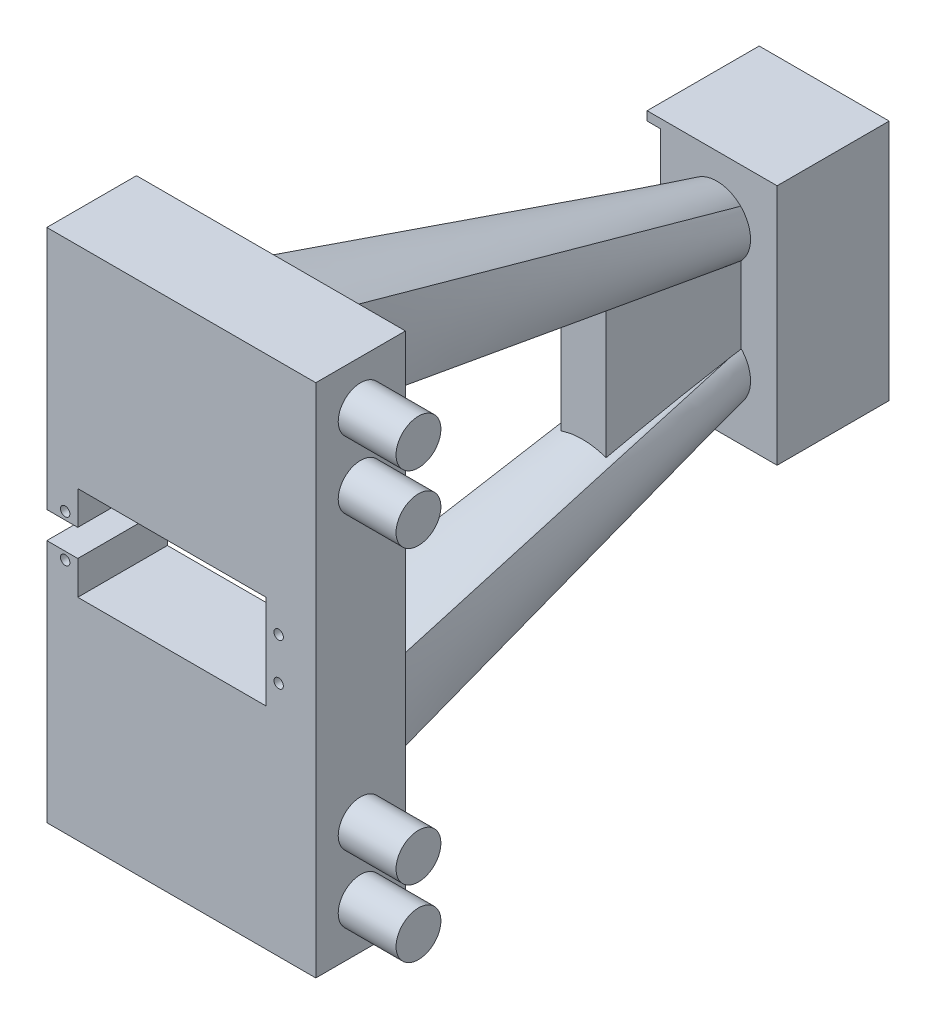
from build123d import *

# Parameters (mm, degrees)
SKETCH_5_W            = 60
SKETCH_5_H            = 115
EXTRUDE_2_DEPTH       = 20
SKETCH_1_R            = 1.05
CUT_EXTRUDE_4_DEPTH   = 20
SKETCH_6_R            = 5
EXTRUDE_3_DEPTH       = 13
EXTRUDE_6_DEPTH       = 3
EXTRUDE_6_DEPTH_BACK  = 26
SKETCH_13_W           = 25
SKETCH_13_H           = 54
SKETCH_16_W           = 22
SKETCH_16_H           = 50
CUT_EXTRUDE_9_DEPTH   = 3
SKETCH_17_W           = 5
SKETCH_17_H           = 15
CUT_EXTRUDE_10_DEPTH  = 8
EXTRUDE_13_DEPTH      = 5
EXTRUDE_13_DEPTH_BACK = 5


with BuildPart() as part:
    # 草圖5 → 填料-伸長2 (new body)
    with BuildSketch(Plane.XY):
        with Locations((85.095319229, -3)):
            Rectangle(SKETCH_5_W, SKETCH_5_H)
    extrude(amount=EXTRUDE_2_DEPTH)

    # 草圖1 → 除料-伸長4 (cut)
    with BuildSketch(Plane.XY):
        with Locations((59.19, 1.7)):
            Circle(SKETCH_1_R)
        with Locations((106.81, 1.7)):
            Circle(SKETCH_1_R)
        with Locations(Location((106.81, -7.7, 0), (0, 0, 180))):
            Circle(SKETCH_1_R)
        with Locations(Location((59.19, -7.7, 0), (0, 0, 180))):
            Circle(SKETCH_1_R)
        Polygon((55, -3), (55, 0), (62, 0), (62, 7.5), (104, 7.5), (104, -13.5), (62, -13.5), (62, -6), (55, -6), align=None)
    extrude(amount=CUT_EXTRUDE_4_DEPTH, mode=Mode.SUBTRACT)

    # 草圖6 → 填料-伸長3 (add)
    with BuildSketch(Plane(origin=(115, 0, 0), x_dir=(0, 0, -1), z_dir=(1, 0, 0))):
        with Locations(Location((-10, 44.5, 0), (0, 0, 180))):
            Circle(SKETCH_6_R)
        with Locations(Location((-10, 29.5, 0), (0, 0, 180))):
            Circle(SKETCH_6_R)
        with Locations(Location((-10, -35.5, 0), (0, 0, 180))):
            Circle(SKETCH_6_R)
        with Locations(Location((-10, -50.5, 0), (0, 0, 180))):
            Circle(SKETCH_6_R)
    extrude(amount=EXTRUDE_3_DEPTH)


with BuildPart() as body_2:
    # 草圖13 → 填料-伸長6 (new, two sides: drawn at the far end of the back side and taken through both)
    with BuildSketch(Plane(origin=(95, 0, 0), x_dir=(0, 0, -1), z_dir=(1, 0, 0)).offset(-EXTRUDE_6_DEPTH_BACK)):
        with Locations((112.5, -3)):
            Rectangle(SKETCH_13_W, SKETCH_13_H)
    extrude(amount=EXTRUDE_6_DEPTH + EXTRUDE_6_DEPTH_BACK)

    # 草圖16 → 除料-伸長9 (cut)
    with BuildSketch(Plane(origin=(69, 0, 0), x_dir=(0, 0, -1), z_dir=(1, 0, 0))):
        with Locations((111, -3)):
            Rectangle(SKETCH_16_W, SKETCH_16_H)
    extrude(amount=CUT_EXTRUDE_9_DEPTH, mode=Mode.SUBTRACT)

    # 草圖17 → 除料-伸長10 (cut)
    with BuildSketch(Plane(origin=(69, 0, 0), x_dir=(0, 0, -1), z_dir=(1, 0, 0))):
        with Locations((102.5, -3)):
            Rectangle(SKETCH_17_W, SKETCH_17_H)
    extrude(amount=CUT_EXTRUDE_10_DEPTH, mode=Mode.SUBTRACT)


with BuildPart() as body_3:
    # 草圖21 → 填料-伸長13 (new, two sides: drawn at the far end of the back side and taken through both)
    with BuildSketch(Plane(origin=(85, 0, 0), x_dir=(0, 0, -1), z_dir=(1, 0, 0)).offset(-EXTRUDE_13_DEPTH_BACK)):
        Polygon((69.839876567, 12.283695651), (69.839876567, -18.283695651), (100, -11.88497246), (99.903514788, -3), (100, 5.88497246), align=None)
    extrude(amount=EXTRUDE_13_DEPTH + EXTRUDE_13_DEPTH_BACK)


with BuildPart() as body_4:
    # Knit 1: read off the stored shape, not the designer's step
    # Knit 1: loft between two sections, ruled curve by curve
    knit_1_from = [
        Edge.make_bspline([(79.266895317, 5.377196179, -100), (79.579395317, 5.064696179, -100), (79.931362244, 4.768290315, -100), (80.709511323, 4.233165726, -100), (81.135733214, 3.994620259, -100), (82.046998926, 3.600245646, -100), (82.531971403, 3.444609801, -100), (83.534778832, 3.234670337, -100), (84.052429223, 3.180497037, -100), (85.087963129, 3.180497037, -100), (85.60561352, 3.234670337, -100), (86.608420949, 3.444609801, -100), (87.093393426, 3.600245646, -100), (88.004659138, 3.994620259, -100), (88.430881029, 4.233165726, -100), (89.209030109, 4.768290315, -100), (89.560997035, 5.064696179, -100), (89.873497035, 5.377196179, -100)], [0, 0, 0, 0, 0.125, 0.125, 0.25, 0.25, 0.375, 0.375, 0.5, 0.5, 0.625, 0.625, 0.75, 0.75, 0.875, 0.875, 1, 1, 1, 1], 3),
        Edge.make_bspline([(89.873497035, 5.377196179, -100), (90.185997035, 5.689696179, -100), (90.482402899, 6.041663105, -100), (91.017527488, 6.819812184, -100), (91.256072955, 7.246034075, -100), (91.650447568, 8.157299787, -100), (91.806083413, 8.642272265, -100), (92.016022877, 9.645079694, -100), (92.070196176, 10.162730084, -100), (92.070196176, 11.19826399, -100), (92.016022877, 11.715914381, -100), (91.806083413, 12.71872181, -100), (91.650447568, 13.203694288, -100), (91.256072955, 14.11496, -100), (91.017527488, 14.541181891, -100), (90.482402899, 15.31933097, -100), (90.185997035, 15.671297896, -100), (89.873497035, 15.983797896, -100)], [0, 0, 0, 0, 0.125, 0.125, 0.25, 0.25, 0.375, 0.375, 0.5, 0.5, 0.625, 0.625, 0.75, 0.75, 0.875, 0.875, 1, 1, 1, 1], 3),
        Edge.make_bspline([(79.266895317, 15.983797896, -100), (78.954395317, 15.671297896, -100), (78.657989454, 15.31933097, -100), (78.122864864, 14.541181891, -100), (77.884319398, 14.11496, -100), (77.489944785, 13.203694288, -100), (77.334308939, 12.71872181, -100), (77.124369476, 11.715914381, -100), (77.070196176, 11.19826399, -100), (77.070196176, 10.162730084, -100), (77.124369476, 9.645079694, -100), (77.334308939, 8.642272265, -100), (77.489944785, 8.157299787, -100), (77.884319398, 7.246034075, -100), (78.122864864, 6.819812184, -100), (78.657989454, 6.041663105, -100), (78.954395317, 5.689696179, -100), (79.266895317, 5.377196179, -100)], [0, 0, 0, 0, 0.125, 0.125, 0.25, 0.25, 0.375, 0.375, 0.5, 0.5, 0.625, 0.625, 0.75, 0.75, 0.875, 0.875, 1, 1, 1, 1], 3),
        Edge.make_bspline([(89.873497035, 15.983797896, -100), (89.560997035, 16.296297896, -100), (89.209030109, 16.59270376, -100), (88.430881029, 17.127828349, -100), (88.004659138, 17.366373816, -100), (87.093393426, 17.760748429, -100), (86.608420949, 17.916384274, -100), (85.60561352, 18.126323738, -100), (85.087963129, 18.180497037, -100), (84.052429223, 18.180497037, -100), (83.534778832, 18.126323738, -100), (82.531971403, 17.916384274, -100), (82.046998926, 17.760748429, -100), (81.135733214, 17.366373816, -100), (80.709511323, 17.127828349, -100), (79.931362244, 16.59270376, -100), (79.579395317, 16.296297896, -100), (79.266895317, 15.983797896, -100)], [0, 0, 0, 0, 0.125, 0.125, 0.25, 0.25, 0.375, 0.375, 0.5, 0.5, 0.625, 0.625, 0.75, 0.75, 0.875, 0.875, 1, 1, 1, 1], 3),
    ]
    knit_1_to = [
        Edge.make_bspline([(75, 27.5, 0), (75.833333333, 27.5, 0), (76.666666667, 27.5, 0), (78.333333333, 27.5, 0), (79.166666667, 27.5, 0), (80.833333333, 27.5, 0), (81.666666667, 27.5, 0), (83.333333333, 27.5, 0), (84.166666667, 27.5, 0), (85.833333333, 27.5, 0), (86.666666667, 27.5, 0), (88.333333333, 27.5, 0), (89.166666667, 27.5, 0), (90.833333333, 27.5, 0), (91.666666667, 27.5, 0), (93.333333333, 27.5, 0), (94.166666667, 27.5, 0), (95, 27.5, 0)], [0, 0, 0, 0, 0.125, 0.125, 0.25, 0.25, 0.375, 0.375, 0.5, 0.5, 0.625, 0.625, 0.75, 0.75, 0.875, 0.875, 1, 1, 1, 1], 3),
        Edge.make_bspline([(95, 27.5, 0), (95, 28.333333333, 0), (95, 29.166666667, 0), (95, 30.833333333, 0), (95, 31.666666667, 0), (95, 33.333333333, 0), (95, 34.166666667, 0), (95, 35.833333333, 0), (95, 36.666666667, 0), (95, 38.333333333, 0), (95, 39.166666667, 0), (95, 40.833333333, 0), (95, 41.666666667, 0), (95, 43.333333333, 0), (95, 44.166666667, 0), (95, 45.833333333, 0), (95, 46.666666667, 0), (95, 47.5, 0)], [0, 0, 0, 0, 0.125, 0.125, 0.25, 0.25, 0.375, 0.375, 0.5, 0.5, 0.625, 0.625, 0.75, 0.75, 0.875, 0.875, 1, 1, 1, 1], 3),
        Edge.make_bspline([(75, 47.5, 0), (75, 46.666666667, 0), (75, 45.833333333, 0), (75, 44.166666667, 0), (75, 43.333333333, 0), (75, 41.666666667, 0), (75, 40.833333333, 0), (75, 39.166666667, 0), (75, 38.333333333, 0), (75, 36.666666667, 0), (75, 35.833333333, 0), (75, 34.166666667, 0), (75, 33.333333333, 0), (75, 31.666666667, 0), (75, 30.833333333, 0), (75, 29.166666667, 0), (75, 28.333333333, 0), (75, 27.5, 0)], [0, 0, 0, 0, 0.125, 0.125, 0.25, 0.25, 0.375, 0.375, 0.5, 0.5, 0.625, 0.625, 0.75, 0.75, 0.875, 0.875, 1, 1, 1, 1], 3),
        Edge.make_bspline([(95, 47.5, 0), (94.166666667, 47.5, 0), (93.333333333, 47.5, 0), (91.666666667, 47.5, 0), (90.833333333, 47.5, 0), (89.166666667, 47.5, 0), (88.333333333, 47.5, 0), (86.666666667, 47.5, 0), (85.833333333, 47.5, 0), (84.166666667, 47.5, 0), (83.333333333, 47.5, 0), (81.666666667, 47.5, 0), (80.833333333, 47.5, 0), (79.166666667, 47.5, 0), (78.333333333, 47.5, 0), (76.666666667, 47.5, 0), (75.833333333, 47.5, 0), (75, 47.5, 0)], [0, 0, 0, 0, 0.125, 0.125, 0.25, 0.25, 0.375, 0.375, 0.5, 0.5, 0.625, 0.625, 0.75, 0.75, 0.875, 0.875, 1, 1, 1, 1], 3),
    ]
    knit_1 = Solid(Shell([*[Face.make_surface_from_curves(knit_1_from[k], knit_1_to[k]) for k in range(4)], Face(Wire(knit_1_from)), Face(Wire(knit_1_to))]))
    add(knit_1)


with BuildPart() as body_5:
    # Knit 2: read off the stored shape, not the designer's step
    # Knit 2: loft between two sections, ruled curve by curve
    knit_2_from = [
        Edge.make_bspline([(79.266895317, -21.983797896, -100), (79.579395317, -22.296297896, -100), (79.931362244, -22.59270376, -100), (80.709511323, -23.127828349, -100), (81.135733214, -23.366373816, -100), (82.046998926, -23.760748429, -100), (82.531971403, -23.916384274, -100), (83.534778832, -24.126323738, -100), (84.052429223, -24.180497037, -100), (85.087963129, -24.180497037, -100), (85.60561352, -24.126323738, -100), (86.608420949, -23.916384274, -100), (87.093393426, -23.760748429, -100), (88.004659138, -23.366373816, -100), (88.430881029, -23.127828349, -100), (89.209030109, -22.59270376, -100), (89.560997035, -22.296297896, -100), (89.873497035, -21.983797896, -100)], [0, 0, 0, 0, 0.125, 0.125, 0.25, 0.25, 0.375, 0.375, 0.5, 0.5, 0.625, 0.625, 0.75, 0.75, 0.875, 0.875, 1, 1, 1, 1], 3),
        Edge.make_bspline([(89.873497035, -21.983797896, -100), (90.185997035, -21.671297896, -100), (90.482402899, -21.31933097, -100), (91.017527488, -20.541181891, -100), (91.256072955, -20.11496, -100), (91.650447568, -19.203694288, -100), (91.806083413, -18.71872181, -100), (92.016022877, -17.715914381, -100), (92.070196176, -17.19826399, -100), (92.070196176, -16.162730084, -100), (92.016022877, -15.645079694, -100), (91.806083413, -14.642272265, -100), (91.650447568, -14.157299787, -100), (91.256072955, -13.246034075, -100), (91.017527488, -12.819812184, -100), (90.482402899, -12.041663105, -100), (90.185997035, -11.689696179, -100), (89.873497035, -11.377196179, -100)], [0, 0, 0, 0, 0.125, 0.125, 0.25, 0.25, 0.375, 0.375, 0.5, 0.5, 0.625, 0.625, 0.75, 0.75, 0.875, 0.875, 1, 1, 1, 1], 3),
        Edge.make_bspline([(79.266895317, -11.377196179, -100), (78.954395317, -11.689696179, -100), (78.657989454, -12.041663105, -100), (78.122864864, -12.819812184, -100), (77.884319398, -13.246034075, -100), (77.489944785, -14.157299787, -100), (77.334308939, -14.642272265, -100), (77.124369476, -15.645079694, -100), (77.070196176, -16.162730084, -100), (77.070196176, -17.19826399, -100), (77.124369476, -17.715914381, -100), (77.334308939, -18.71872181, -100), (77.489944785, -19.203694288, -100), (77.884319398, -20.11496, -100), (78.122864864, -20.541181891, -100), (78.657989454, -21.31933097, -100), (78.954395317, -21.671297896, -100), (79.266895317, -21.983797896, -100)], [0, 0, 0, 0, 0.125, 0.125, 0.25, 0.25, 0.375, 0.375, 0.5, 0.5, 0.625, 0.625, 0.75, 0.75, 0.875, 0.875, 1, 1, 1, 1], 3),
        Edge.make_bspline([(89.873497035, -11.377196179, -100), (89.560997035, -11.064696179, -100), (89.209030109, -10.768290315, -100), (88.430881029, -10.233165726, -100), (88.004659138, -9.994620259, -100), (87.093393426, -9.600245646, -100), (86.608420949, -9.444609801, -100), (85.60561352, -9.234670337, -100), (85.087963129, -9.180497037, -100), (84.052429223, -9.180497037, -100), (83.534778832, -9.234670337, -100), (82.531971403, -9.444609801, -100), (82.046998926, -9.600245646, -100), (81.135733214, -9.994620259, -100), (80.709511323, -10.233165726, -100), (79.931362244, -10.768290315, -100), (79.579395317, -11.064696179, -100), (79.266895317, -11.377196179, -100)], [0, 0, 0, 0, 0.125, 0.125, 0.25, 0.25, 0.375, 0.375, 0.5, 0.5, 0.625, 0.625, 0.75, 0.75, 0.875, 0.875, 1, 1, 1, 1], 3),
    ]
    knit_2_to = [
        Edge.make_bspline([(75, -53.5, 0), (75.833333333, -53.5, 0), (76.666666667, -53.5, 0), (78.333333333, -53.5, 0), (79.166666667, -53.5, 0), (80.833333333, -53.5, 0), (81.666666667, -53.5, 0), (83.333333333, -53.5, 0), (84.166666667, -53.5, 0), (85.833333333, -53.5, 0), (86.666666667, -53.5, 0), (88.333333333, -53.5, 0), (89.166666667, -53.5, 0), (90.833333333, -53.5, 0), (91.666666667, -53.5, 0), (93.333333333, -53.5, 0), (94.166666667, -53.5, 0), (95, -53.5, 0)], [0, 0, 0, 0, 0.125, 0.125, 0.25, 0.25, 0.375, 0.375, 0.5, 0.5, 0.625, 0.625, 0.75, 0.75, 0.875, 0.875, 1, 1, 1, 1], 3),
        Edge.make_bspline([(95, -53.5, 0), (95, -52.666666667, 0), (95, -51.833333333, 0), (95, -50.166666667, 0), (95, -49.333333333, 0), (95, -47.666666667, 0), (95, -46.833333333, 0), (95, -45.166666667, 0), (95, -44.333333333, 0), (95, -42.666666667, 0), (95, -41.833333333, 0), (95, -40.166666667, 0), (95, -39.333333333, 0), (95, -37.666666667, 0), (95, -36.833333333, 0), (95, -35.166666667, 0), (95, -34.333333333, 0), (95, -33.5, 0)], [0, 0, 0, 0, 0.125, 0.125, 0.25, 0.25, 0.375, 0.375, 0.5, 0.5, 0.625, 0.625, 0.75, 0.75, 0.875, 0.875, 1, 1, 1, 1], 3),
        Edge.make_bspline([(75, -33.5, 0), (75, -34.333333333, 0), (75, -35.166666667, 0), (75, -36.833333333, 0), (75, -37.666666667, 0), (75, -39.333333333, 0), (75, -40.166666667, 0), (75, -41.833333333, 0), (75, -42.666666667, 0), (75, -44.333333333, 0), (75, -45.166666667, 0), (75, -46.833333333, 0), (75, -47.666666667, 0), (75, -49.333333333, 0), (75, -50.166666667, 0), (75, -51.833333333, 0), (75, -52.666666667, 0), (75, -53.5, 0)], [0, 0, 0, 0, 0.125, 0.125, 0.25, 0.25, 0.375, 0.375, 0.5, 0.5, 0.625, 0.625, 0.75, 0.75, 0.875, 0.875, 1, 1, 1, 1], 3),
        Edge.make_bspline([(95, -33.5, 0), (94.166666667, -33.5, 0), (93.333333333, -33.5, 0), (91.666666667, -33.5, 0), (90.833333333, -33.5, 0), (89.166666667, -33.5, 0), (88.333333333, -33.5, 0), (86.666666667, -33.5, 0), (85.833333333, -33.5, 0), (84.166666667, -33.5, 0), (83.333333333, -33.5, 0), (81.666666667, -33.5, 0), (80.833333333, -33.5, 0), (79.166666667, -33.5, 0), (78.333333333, -33.5, 0), (76.666666667, -33.5, 0), (75.833333333, -33.5, 0), (75, -33.5, 0)], [0, 0, 0, 0, 0.125, 0.125, 0.25, 0.25, 0.375, 0.375, 0.5, 0.5, 0.625, 0.625, 0.75, 0.75, 0.875, 0.875, 1, 1, 1, 1], 3),
    ]
    knit_2 = Solid(Shell([*[Face.make_surface_from_curves(knit_2_from[k], knit_2_to[k]) for k in range(4)], Face(Wire(knit_2_from)), Face(Wire(knit_2_to))]))
    add(knit_2)


solid = Compound([part.part, body_2.part, body_3.part, body_4.part, body_5.part])
